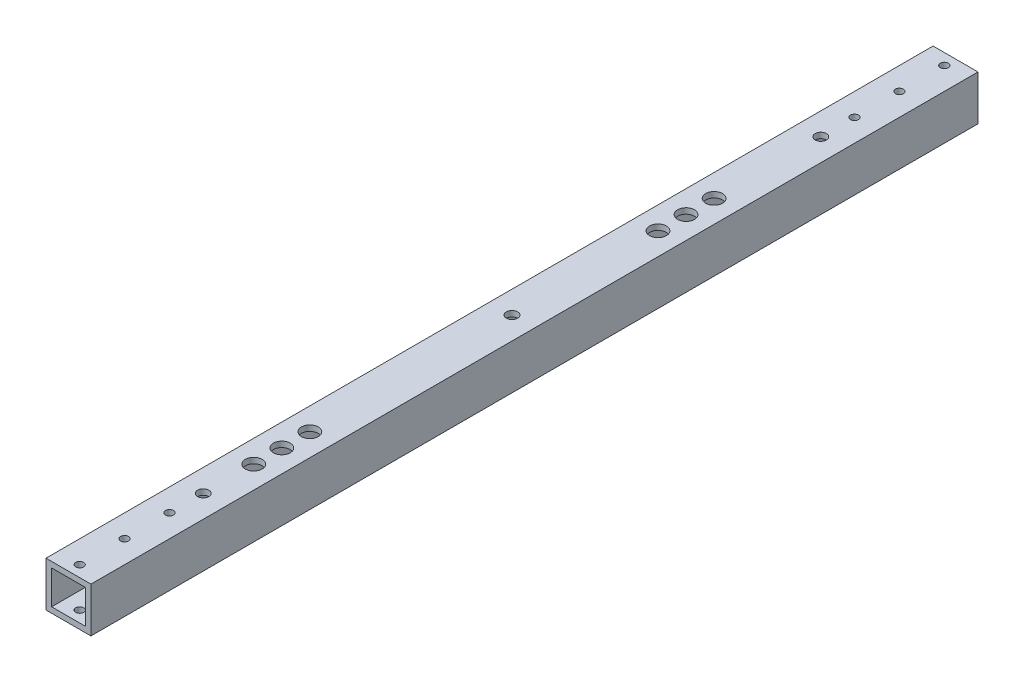
from build123d import *

# Parameters (mm, degrees)
SKETCH1_W                       = 25.4
SKETCH1_H                       = 25.4
SKETCH1_W_2                     = 19.05
SKETCH1_H_2                     = 19.05
EXTRUDE_THIN1_DEPTH             = 501.65
F_8_CLEARANCE_HOLE1_D           = 4.4958
F_1_4_0_25_DIAMETER_HOLE1_D     = 6.35
F_1_4_0_25_DIAMETER_HOLE1_DEPTH = 28.575
F_1_4_0_25_DIAMETER_HOLE1_TIP   = 1.907732465
F_3_8_0_375_DIAMETER_HOLE2_D    = 9.525


with BuildPart() as part:
    # Sketch1 → Extrude-Thin1 (new body)
    with BuildSketch(Plane.XY):
        Rectangle(SKETCH1_W, SKETCH1_H)
        Rectangle(SKETCH1_W_2, SKETCH1_H_2, mode=Mode.SUBTRACT)
    extrude(amount=EXTRUDE_THIN1_DEPTH)

    # #8 Clearance Hole1 (through all)
    with Locations(Plane(origin=(0, 12.7, 495.3), x_dir=(0, 0, 1), z_dir=(0, 1, 0))):
        with Locations((0, 0), (-488.95, 0), (-463.55, 0), (-438.15, 0), (-25.4, 0), (-50.8, 0)):
            Hole(F_8_CLEARANCE_HOLE1_D / 2)

    # 1/4 (0.25) Diameter Hole1
    with Locations(Plane(origin=(381, 12.7, 250.825), x_dir=(1, 0, 0), z_dir=(0, 1, 0))):
        with Locations((-381, 174.625), (-381, 0), (-381, -174.625)):
            Hole(F_1_4_0_25_DIAMETER_HOLE1_D / 2, depth=F_1_4_0_25_DIAMETER_HOLE1_DEPTH)
            with Locations((0, 0, -(F_1_4_0_25_DIAMETER_HOLE1_DEPTH + F_1_4_0_25_DIAMETER_HOLE1_TIP / 2))):  # 118° drill point
                Cone(0, F_1_4_0_25_DIAMETER_HOLE1_D / 2, F_1_4_0_25_DIAMETER_HOLE1_TIP, mode=Mode.SUBTRACT)

    # 3/8 (0.375) Diameter Hole2 (through all)
    with Locations(Plane(origin=(381, 12.7, 250.825), x_dir=(1, 0, 0), z_dir=(0, 1, 0))):
        with Locations((-92.583, 346.075), (-35.433, 346.075), (35.814, 346.075), (92.964, 346.075), (-22.9616, -346.775), (50.0634, -346.775), (123.0884, -346.775), (-381, 114.3), (-381, 98.425), (-381, 82.55), (-381, -114.3), (-381, -130.175), (-381, -146.05)):
            Hole(F_3_8_0_375_DIAMETER_HOLE2_D / 2)


solid = part.part
